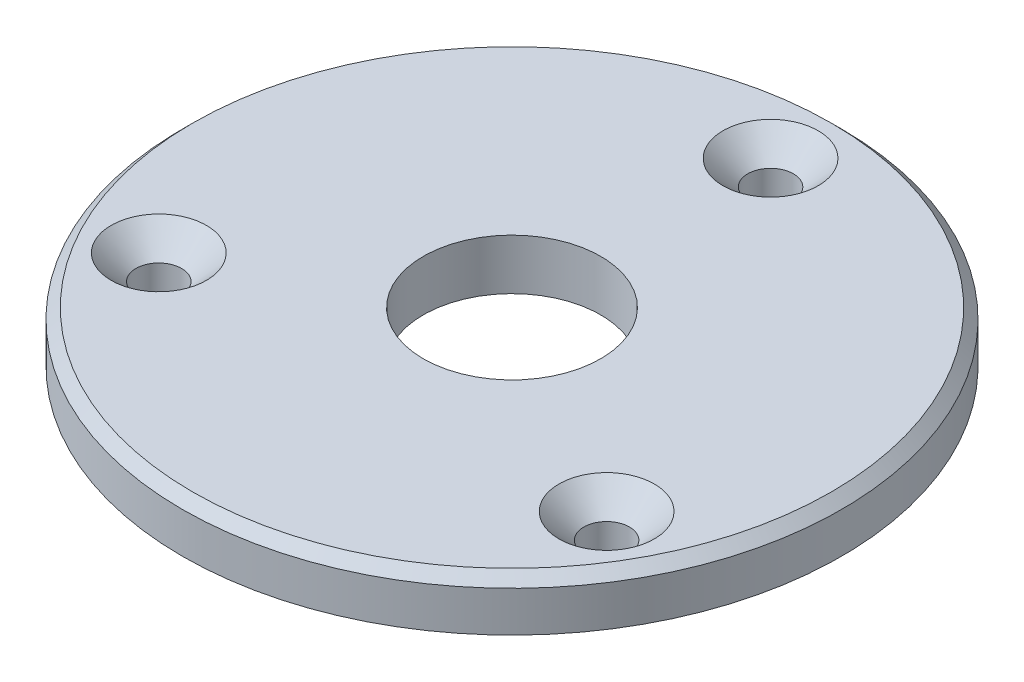
from build123d import *

# Parameters (mm, degrees)
SKETCH1_R                                     = 32.5
BOSS_EXTRUDE1_DEPTH                           = 5
CHAMFER1_SIZE                                 = 1
CSK_FOR_M4_COUNTERSUNK_FLAT_HEAD1_D           = 4.5
CSK_FOR_M4_COUNTERSUNK_FLAT_HEAD1_CSINK_D     = 9.4
CSK_FOR_M4_COUNTERSUNK_FLAT_HEAD1_CSINK_ANGLE = 90
M20X2_5_TAPPED_HOLE1_D                        = 17.5
M20X2_5_TAPPED_HOLE1_ON_FACE_2_D              = 17.5
CIRPATTERN1_COUNT                             = 3


with BuildPart() as part:
    # Sketch1 → Boss-Extrude1 (new body)
    with BuildSketch(Plane(origin=(0, 0, 0), x_dir=(1, 0, 0), z_dir=(0, 1, 0))):
        Circle(SKETCH1_R)
    extrude(amount=BOSS_EXTRUDE1_DEPTH)

    # Chamfer1
    chamfer1_edges = [part.edges().sort_by_distance(p)[0] for p in [
        (-32.5, 5, 0),
    ]]
    chamfer(chamfer1_edges, length=CHAMFER1_SIZE)

    # CSK for M4 Countersunk Flat Head1 (through all)
    with Locations(Plane(origin=(0, 5, -25.5), x_dir=(0, 0, 1), z_dir=(0, 1, 0))):
        with Locations((0, 0)):
            csk_for_m4_countersunk_flat_head1 = CounterSinkHole(CSK_FOR_M4_COUNTERSUNK_FLAT_HEAD1_D / 2, CSK_FOR_M4_COUNTERSUNK_FLAT_HEAD1_CSINK_D / 2, counter_sink_angle=CSK_FOR_M4_COUNTERSUNK_FLAT_HEAD1_CSINK_ANGLE)

    # M20x2.5 Tapped Hole1 (through all)
    with Locations(Plane(origin=(0, 0, 0), x_dir=(0, 0, -1), z_dir=(0, -1, 0))):
        with Locations((0, 0)):
            Hole(M20X2_5_TAPPED_HOLE1_D / 2)

    # M20x2.5 Tapped Hole1 on face 2 (through all)
    with Locations(Plane.ZX.offset(5)):
        with Locations((0, 0)):
            Hole(M20X2_5_TAPPED_HOLE1_ON_FACE_2_D / 2)

    # CirPattern1: CSK for M4 Countersunk Flat Head1 ×3 about axis
    cirpattern1_axis = Axis((0, 5, 0), (0, 1, 0))
    for i in range(1, CIRPATTERN1_COUNT):
        add(csk_for_m4_countersunk_flat_head1.rotate(cirpattern1_axis, i * 360 / CIRPATTERN1_COUNT), mode=Mode.SUBTRACT)


solid = part.part
